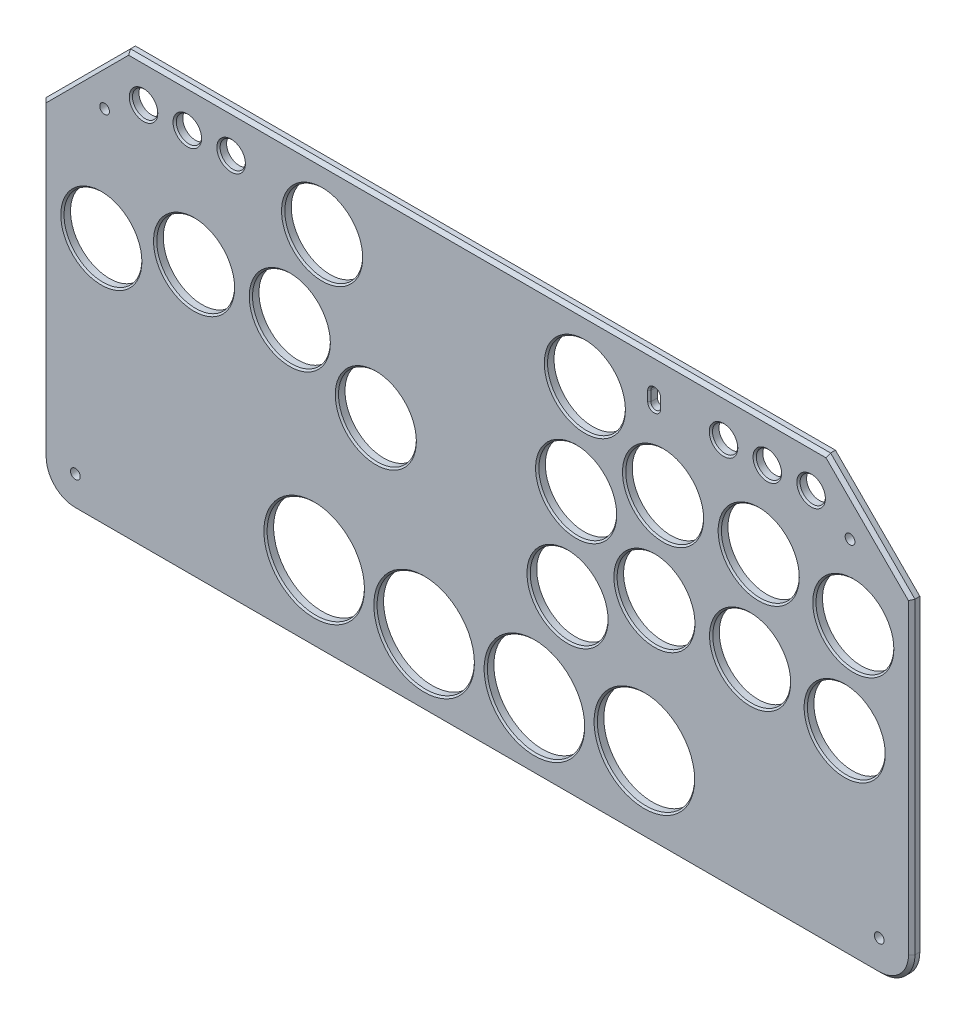
from build123d import *

# Parameters (mm, degrees)
BOSS_EXTRUDE1_DEPTH   = 2.5
SKETCH24_R            = 3.9
CUT_EXTRUDE2_DEPTH    = 307.16304509
SKETCH1_R             = 12
SKETCH1_R_2           = 15
CUT_EXTRUDE3_DEPTH    = 307.16304509
F_3_0MM_DOWEL_HOLE1_D = 3
CHAMFER1_SIZE         = 1
CHAMFER2_SIZE         = 0.5


with BuildPart() as part:
    # Sketch2 → Boss-Extrude1 (new body)
    with BuildSketch(Plane.XY):
        with BuildLine():
            Line((6.41186441, 110.238694526), (6.41186441, 15.286374556))
            ThreePointArc((6.41186441, 15.286374556), (9.340796598, 8.215306744), (16.41186441, 5.286374556))
            Line((16.41186441, 5.286374556), (264.168886442, 5.286374556))
            ThreePointArc((264.168886442, 5.286374556), (271.239954254, 8.215306744), (274.168886442, 15.286374556))
            Line((274.168886442, 15.286374556), (274.168886442, 110.238694526))
            Line((274.168886442, 110.238694526), (248.168886442, 136.238694526))
            Line((248.168886442, 136.238694526), (32.41186441, 136.238694526))
            Line((32.41186441, 136.238694526), (6.41186441, 110.238694526))
        make_face()
    extrude(amount=-BOSS_EXTRUDE1_DEPTH)

    # Sketch24 → Cut-Extrude2 (cut, through all)
    with BuildSketch(Plane.XY):
        with Locations((37.41186441, 124.238694526)):
            Circle(SKETCH24_R)
        with Locations((50.91186441, 124.238694526)):
            Circle(SKETCH24_R)
        with Locations((64.41186441, 124.238694526)):
            Circle(SKETCH24_R)
        with Locations((216.168886442, 124.238694526)):
            Circle(SKETCH24_R)
        with Locations((229.668886442, 124.238694526)):
            Circle(SKETCH24_R)
        with Locations((243.168886442, 124.238694526)):
            Circle(SKETCH24_R)
        with BuildLine():
            Line((193.298949614, 125.738694526), (193.298949614, 122.738694526))
            ThreePointArc((193.298949614, 122.738694526), (194.798949614, 121.238694526), (196.298949614, 122.738694526))
            Line((196.298949614, 122.738694526), (196.298949614, 125.738694526))
            ThreePointArc((196.298949614, 125.738694526), (194.798949614, 127.238694526), (193.298949614, 125.738694526))
        make_face()
    extrude(amount=-CUT_EXTRUDE2_DEPTH, mode=Mode.SUBTRACT)

    # Sketch1 → Cut-Extrude3 (cut, through all)
    with BuildSketch(Plane.XY):
        with Locations((24.41186441, 82.179064133)):
            Circle(SKETCH1_R)
        with Locations((52.996556322, 89.470524089)):
            Circle(SKETCH1_R)
        with Locations((92.45540719, 117.238694526)):
            Circle(SKETCH1_R)
        with Locations((82.496556322, 89.470524089)):
            Circle(SKETCH1_R)
        with Locations((109.001946024, 76.520067852)):
            Circle(SKETCH1_R)
        with Locations((168.091946024, 58.360067852)):
            Circle(SKETCH1_R)
        with Locations((194.873540874, 70.729230202)):
            Circle(SKETCH1_R)
        with Locations((224.358659158, 69.792320505)):
            Circle(SKETCH1_R)
        with Locations((253.510608286, 65.274150291)):
            Circle(SKETCH1_R)
        with Locations((256.168886442, 94.654135948)):
            Circle(SKETCH1_R)
        with Locations((227.016937315, 99.172306162)):
            Circle(SKETCH1_R)
        with Locations((197.531819031, 100.10921586)):
            Circle(SKETCH1_R)
        with Locations((170.75022418, 87.740053509)):
            Circle(SKETCH1_R)
        with Locations((191.774681199, 29.091460603)):
            Circle(SKETCH1_R_2)
        with Locations((157.891946024, 26.270067852)):
            Circle(SKETCH1_R_2)
        with Locations((123.891946024, 26.270067852)):
            Circle(SKETCH1_R_2)
        with Locations((90.009210849, 29.091460603)):
            Circle(SKETCH1_R_2)
        with Locations((173.429012786, 117.118176179)):
            Circle(SKETCH1_R)
    extrude(amount=-CUT_EXTRUDE3_DEPTH, mode=Mode.SUBTRACT)

    # Ø3.0mm Dowel Hole1 (through all)
    with Locations(Plane.XY):
        with Locations((25.42227205, 117.228286886), (16.41186441, 15.286374556), (264.168886442, 15.286374556), (255.158478802, 117.228286886)):
            Hole(F_3_0MM_DOWEL_HOLE1_D / 2)

    # Chamfer1
    chamfer1_edges = [part.edges().sort_by_distance(p)[0] for p in [
        (274.168886442, 62.762534541, 0),
        (271.239954254, 8.215306744, 0),
        (140.290375426, 5.286374556, 0),
        (9.340796598, 8.215306744, 0),
        (261.168886442, 123.238694526, 0),
        (140.290375426, 136.238694526, 0),
        (6.41186441, 62.762534541, 0),
        (19.41186441, 123.238694526, 0),
    ]]
    chamfer(chamfer1_edges, length=CHAMFER1_SIZE)

    # Chamfer2
    chamfer2_edges = [part.edges().sort_by_distance(p)[0] for p in [
        (239.268886442, 124.238694526, 0),
        (225.768886442, 124.238694526, 0),
        (212.268886442, 124.238694526, 0),
        (193.298949614, 124.238694526, 0),
        (194.798949614, 121.238694526, 0),
        (194.798949614, 127.238694526, 0),
        (196.298949614, 124.238694526, 0),
        (60.51186441, 124.238694526, 0),
        (47.01186441, 124.238694526, 0),
        (33.51186441, 124.238694526, 0),
        (161.429012786, 117.118176179, 0),
        (244.168886442, 94.654135948, 0),
        (215.016937315, 99.172306162, 0),
        (185.531819031, 100.10921586, 0),
        (158.75022418, 87.740053509, 0),
        (182.873540874, 70.729230202, 0),
        (212.358659158, 69.792320505, 0),
        (241.510608286, 65.274150291, 0),
        (176.774681199, 29.091460603, 0),
        (156.091946024, 58.360067852, 0),
        (142.891946024, 26.270067852, 0),
        (108.891946024, 26.270067852, 0),
        (97.001946024, 76.520067852, 0),
        (75.009210849, 29.091460603, 0),
        (80.45540719, 117.238694526, 0),
        (70.496556322, 89.470524089, 0),
        (40.996556322, 89.470524089, 0),
        (12.41186441, 82.179064133, 0),
    ]]
    chamfer(chamfer2_edges, length=CHAMFER2_SIZE)


solid = part.part
